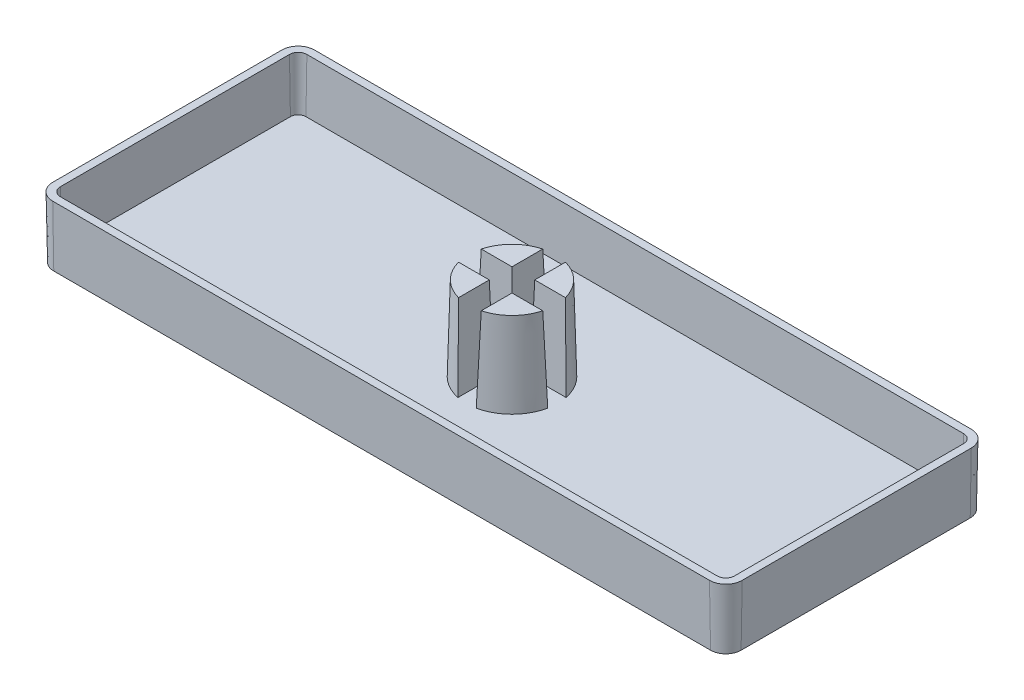
from build123d import *

# Parameters (mm, degrees)
BOSS_EXTRUDE1_DEPTH           = 4
BOSS_EXTRUDE1_DRAFT           = -1
SHELL1_T                      = -0.5
BOSS_EXTRUDE2_DEPTH           = 5.5
BOSS_EXTRUDE2_DRAFT           = 1.5
BOSS_EXTRUDE2_PROFILE_2_DEPTH = 5.5
BOSS_EXTRUDE2_PROFILE_2_DRAFT = 1.5
BOSS_EXTRUDE2_PROFILE_3_DEPTH = 5.5
BOSS_EXTRUDE2_PROFILE_3_DRAFT = 1.5
BOSS_EXTRUDE2_PROFILE_4_DEPTH = 5.5
BOSS_EXTRUDE2_PROFILE_4_DRAFT = 1.5


with BuildPart() as part:
    # Sketch1 → Boss-Extrude1 (with draft: the straight prism first)
    with BuildSketch(Plane(origin=(0, 0, 0), x_dir=(1, 0, 0), z_dir=(0, 1, 0))):
        with BuildLine():
            Line((-21.5, -8.5), (21.5, -8.5))
            ThreePointArc((21.5, -8.5), (22.207106781, -8.207106781), (22.5, -7.5))
            Line((22.5, -7.5), (22.5, 7.5))
            ThreePointArc((22.5, 7.5), (22.207106781, 8.207106781), (21.5, 8.5))
            Line((21.5, 8.5), (-21.5, 8.5))
            ThreePointArc((-21.5, 8.5), (-22.207106781, 8.207106781), (-22.5, 7.5))
            Line((-22.5, 7.5), (-22.5, -7.5))
            ThreePointArc((-22.5, -7.5), (-22.207106781, -8.207106781), (-21.5, -8.5))
        make_face()
    extrude(amount=BOSS_EXTRUDE1_DEPTH)
    # Boss-Extrude1: the draft: its side faces are tilted about the plane it starts from
    boss_extrude1_sides = [part.faces().sort_by_distance(p)[0] for p in [
        (0, 2, 8.5),
        (22.207106781, 2, 8.207106781),
        (22.5, 2, 0),
        (22.207106781, 2, -8.207106781),
        (0, 2, -8.5),
        (-22.207106781, 2, -8.207106781),
        (-22.5, 2, 0),
        (-22.207106781, 2, 8.207106781),
    ]]
    draft(boss_extrude1_sides, Plane(origin=(0, 0, 0), x_dir=(1, 0, 0), z_dir=(0, 1, 0)), BOSS_EXTRUDE1_DRAFT)

    # Shell1
    shell1_openings = [part.faces().sort_by_distance(p)[0] for p in [
        (0, 4, 0),
    ]]
    offset(amount=SHELL1_T, openings=shell1_openings, kind=Kind.INTERSECTION)


with BuildPart() as boss_extrude2_tool:
    # Sketch2 → Boss-Extrude2 (with draft: the straight prism first)
    with BuildSketch(Plane(origin=(0, 0.5, 0), x_dir=(1, 0, 0), z_dir=(0, 1, 0))):
        with BuildLine():
            ThreePointArc((-0.6, 2.939387691), (-2.121320344, 2.121320344), (-2.939387691, 0.6))
            Line((-2.939387691, 0.6), (-0.6, 0.6))
            Line((-0.6, 0.6), (-0.6, 2.939387691))
        make_face()
    extrude(amount=BOSS_EXTRUDE2_DEPTH)
    # Boss-Extrude2: the draft: its side faces are tilted about the plane it starts from
    boss_extrude2_sides = [boss_extrude2_tool.faces().sort_by_distance(p)[0] for p in [
        (-2.121320344, 3.25, -2.121320344),
        (-1.769693846, 3.25, -0.6),
        (-0.6, 3.25, -1.769693846),
    ]]
    draft(boss_extrude2_sides, Plane(origin=(0, 0.5, 0), x_dir=(1, 0, 0), z_dir=(0, 1, 0)), BOSS_EXTRUDE2_DRAFT)


with BuildPart() as part_1:
    add(part.part)

    # Boss-Extrude2: add boss_extrude2_tool
    add(boss_extrude2_tool.part)


with BuildPart() as boss_extrude2_profile_2_tool:
    # Sketch2 → Boss-Extrude2 profile 2 (with draft: the straight prism first)
    with BuildSketch(Plane(origin=(0, 0.5, 0), x_dir=(1, 0, 0), z_dir=(0, 1, 0))):
        with BuildLine():
            ThreePointArc((-2.939387691, -0.6), (-2.121320344, -2.121320344), (-0.6, -2.939387691))
            Line((-0.6, -2.939387691), (-0.6, -0.6))
            Line((-0.6, -0.6), (-2.939387691, -0.6))
        make_face()
    extrude(amount=BOSS_EXTRUDE2_PROFILE_2_DEPTH)
    # Boss-Extrude2 profile 2: the draft: its side faces are tilted about the plane it starts from
    boss_extrude2_profile_2_sides = [boss_extrude2_profile_2_tool.faces().sort_by_distance(p)[0] for p in [
        (-2.121320344, 3.25, 2.121320344),
        (-0.6, 3.25, 1.769693846),
        (-1.769693846, 3.25, 0.6),
    ]]
    draft(boss_extrude2_profile_2_sides, Plane(origin=(0, 0.5, 0), x_dir=(1, 0, 0), z_dir=(0, 1, 0)), BOSS_EXTRUDE2_PROFILE_2_DRAFT)


with BuildPart() as part_2:
    add(part_1.part)

    # Boss-Extrude2 profile 2: add boss_extrude2_profile_2_tool
    add(boss_extrude2_profile_2_tool.part)


with BuildPart() as boss_extrude2_profile_3_tool:
    # Sketch2 → Boss-Extrude2 profile 3 (with draft: the straight prism first)
    with BuildSketch(Plane(origin=(0, 0.5, 0), x_dir=(1, 0, 0), z_dir=(0, 1, 0))):
        with BuildLine():
            Line((0.6, 2.939387691), (0.6, 0.6))
            Line((0.6, 0.6), (2.939387691, 0.6))
            ThreePointArc((2.939387691, 0.6), (2.121320344, 2.121320344), (0.6, 2.939387691))
        make_face()
    extrude(amount=BOSS_EXTRUDE2_PROFILE_3_DEPTH)
    # Boss-Extrude2 profile 3: the draft: its side faces are tilted about the plane it starts from
    boss_extrude2_profile_3_sides = [boss_extrude2_profile_3_tool.faces().sort_by_distance(p)[0] for p in [
        (0.6, 3.25, -1.769693846),
        (1.769693846, 3.25, -0.6),
        (2.121320344, 3.25, -2.121320344),
    ]]
    draft(boss_extrude2_profile_3_sides, Plane(origin=(0, 0.5, 0), x_dir=(1, 0, 0), z_dir=(0, 1, 0)), BOSS_EXTRUDE2_PROFILE_3_DRAFT)


with BuildPart() as part_3:
    add(part_2.part)

    # Boss-Extrude2 profile 3: add boss_extrude2_profile_3_tool
    add(boss_extrude2_profile_3_tool.part)


with BuildPart() as boss_extrude2_profile_4_tool:
    # Sketch2 → Boss-Extrude2 profile 4 (with draft: the straight prism first)
    with BuildSketch(Plane(origin=(0, 0.5, 0), x_dir=(1, 0, 0), z_dir=(0, 1, 0))):
        with BuildLine():
            Line((0.6, -0.6), (0.6, -2.939387691))
            ThreePointArc((0.6, -2.939387691), (2.121320344, -2.121320344), (2.939387691, -0.6))
            Line((2.939387691, -0.6), (0.6, -0.6))
        make_face()
    extrude(amount=BOSS_EXTRUDE2_PROFILE_4_DEPTH)
    # Boss-Extrude2 profile 4: the draft: its side faces are tilted about the plane it starts from
    boss_extrude2_profile_4_sides = [boss_extrude2_profile_4_tool.faces().sort_by_distance(p)[0] for p in [
        (1.769693846, 3.25, 0.6),
        (0.6, 3.25, 1.769693846),
        (2.121320344, 3.25, 2.121320344),
    ]]
    draft(boss_extrude2_profile_4_sides, Plane(origin=(0, 0.5, 0), x_dir=(1, 0, 0), z_dir=(0, 1, 0)), BOSS_EXTRUDE2_PROFILE_4_DRAFT)


with BuildPart() as part_4:
    add(part_3.part)

    # Boss-Extrude2 profile 4: add boss_extrude2_profile_4_tool
    add(boss_extrude2_profile_4_tool.part)


solid = part_4.part
